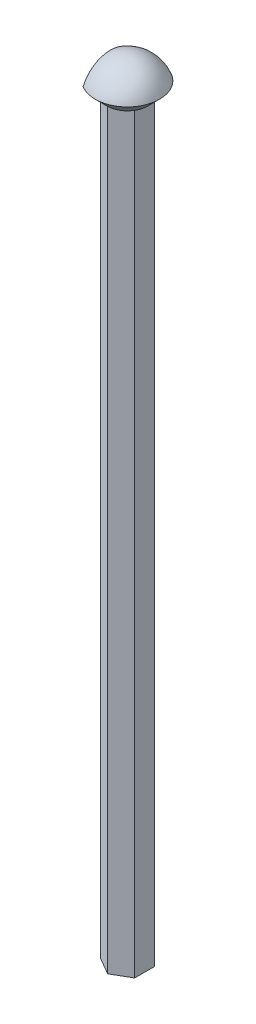
from build123d import *

# Parameters (mm, degrees)
BOSS_EXTRUDE1_DEPTH = 139.7
SKETCH3_R           = 6.35
BOSS_EXTRUDE2_DEPTH = 6.35
FILLET1_R           = 6.35
CHAMFER1_SIZE       = 2.54
SKETCH4_W           = 9.672441956
SKETCH4_H           = 22.08614384
CUT_EXTRUDE1_DEPTH  = 152.4


# Some blends are built 0.0001 mm under size
with BuildPart() as part:
    # Sketch1 → Boss-Extrude1 (new body)
    with BuildSketch(Plane(origin=(0, 0, 0), x_dir=(1, 0, 0), z_dir=(0, 1, 0))):
        Polygon((0, 3.666174209), (-3.175, 1.833087105), (-3.175, -1.833087105), (0, -3.666174209), (3.175, -1.833087105), (3.175, 1.833087105), align=None)
    extrude(amount=BOSS_EXTRUDE1_DEPTH)

    # Sketch3 → Boss-Extrude2 (add)
    with BuildSketch(Plane(origin=(0, 139.7, 0), x_dir=(1, 0, 0), z_dir=(0, 1, 0))):
        with Locations(Location((0, 0, 0), (0, 0, 270))):
            Circle(SKETCH3_R)
    extrude(amount=BOSS_EXTRUDE2_DEPTH)

    # Fillet1
    fillet1_edges = [part.edges().sort_by_distance(p)[0] for p in [
        (0, 146.05, -6.35),
    ]]
    fillet(fillet1_edges, radius=FILLET1_R - 0.0001)  # a hair under: the kernel refuses the full size

    # Chamfer1
    # the kernel refuses this chamfer: 2.54 mm, written as the material it takes off along each edge
    with BuildSketch(Plane(origin=(0, 139.7, 0), x_dir=(0, 0, 1), z_dir=(-1, 0, 0))) as chamfer1_piece_1:
        Polygon((6.35, CHAMFER1_SIZE), (6.35 - CHAMFER1_SIZE, 0), (6.35, 0), align=None)
    revolve(axis=Axis((0, 139.7, 0), (0, 1, 0)), mode=Mode.SUBTRACT)

    # Sketch4 → Cut-Extrude1 (cut)
    with BuildSketch(Plane.XZ):
        with Locations((-8.011220978, 1.321657353)):
            Rectangle(SKETCH4_W, SKETCH4_H)
    extrude(amount=-CUT_EXTRUDE1_DEPTH, mode=Mode.SUBTRACT)


solid = part.part
